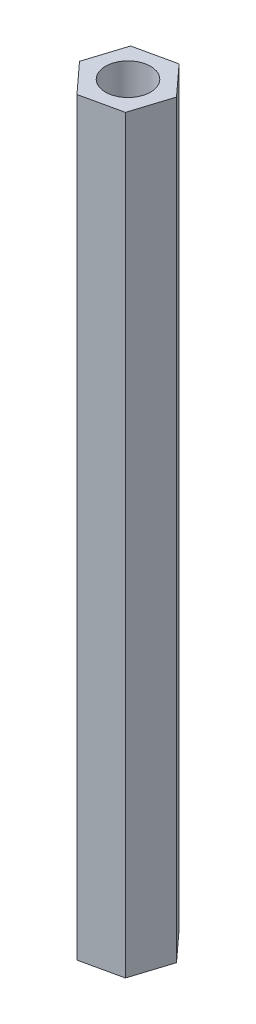
from build123d import *

# Parameters (mm, degrees)
SKETCH1_R           = 1.5
BOSS_EXTRUDE1_DEPTH = 50


with BuildPart() as part:
    # Sketch1 → Boss-Extrude1 (new body)
    with BuildSketch(Plane(origin=(0, 0, 0), x_dir=(1, 0, 0), z_dir=(0, 1, 0))):
        Polygon((-1.83059371, 2.003062655), (-2.65, -0.58380933), (-0.81940629, -2.586871985), (1.83059371, -2.003062655), (2.65, 0.58380933), (0.81940629, 2.586871985), align=None)
        Circle(SKETCH1_R, mode=Mode.SUBTRACT)
    extrude(amount=BOSS_EXTRUDE1_DEPTH)


solid = part.part
